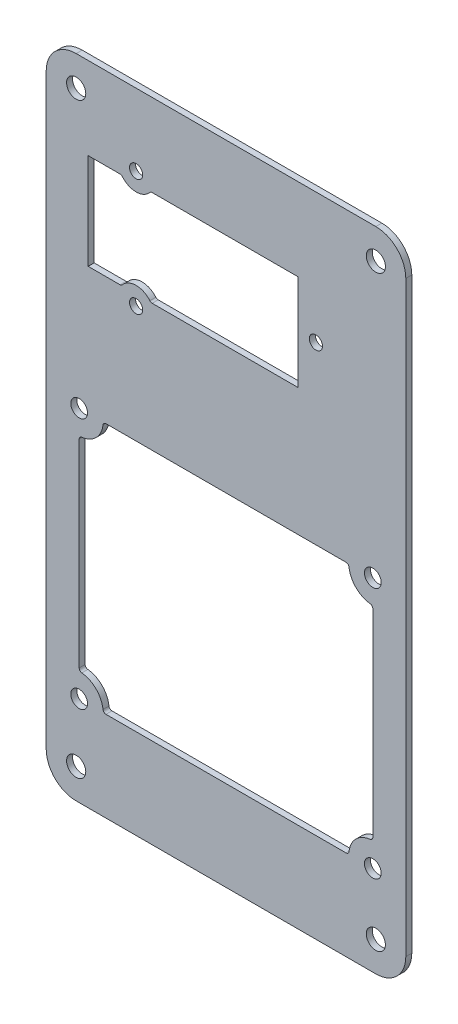
from build123d import *

# Parameters (mm, degrees)
SKETCH_1_W          = 60
SKETCH_1_H          = 108
EXTRUDE_1_DEPTH     = 1
SKETCH_4_R          = 1.4
CUT_EXTRUDE_2_DEPTH = 10
SKETCH_9_R          = 1.6
CUT_EXTRUDE_5_DEPTH = 62.781874365
FILLET_1_R          = 5
SKETCH_10_R         = 1.1
CUT_EXTRUDE_6_DEPTH = 10
CUT_EXTRUDE_7_DEPTH = 10
CUT_EXTRUDE_8_DEPTH = 10
FILLET_2_R          = 0.5
FILLET_3_R          = 0.5


with BuildPart() as part:
    # ｽｹｯﾁ1 → ﾎﾞｽ - 押し出し1 (new body)
    with BuildSketch(Plane.XY):
        Rectangle(SKETCH_1_W, SKETCH_1_H)
    extrude(amount=EXTRUDE_1_DEPTH)

    # ｽｹｯﾁ4 → ｶｯﾄ - 押し出し2 (cut)
    with BuildSketch(Plane.XY.offset(1)):
        with Locations((-24.5, 3)):
            Circle(SKETCH_4_R)
        with Locations((-24.5, -39)):
            Circle(SKETCH_4_R)
        with Locations((24.5, 3)):
            Circle(SKETCH_4_R)
        with Locations((24.5, -39)):
            Circle(SKETCH_4_R)
    extrude(amount=-CUT_EXTRUDE_2_DEPTH, mode=Mode.SUBTRACT)

    # ｽｹｯﾁ9 → ｶｯﾄ - 押し出し5 (cut, through all)
    with BuildSketch(Plane.XY.offset(1)):
        with Locations((25, 49)):
            Circle(SKETCH_9_R)
        with Locations((-25, 49)):
            Circle(SKETCH_9_R)
        with Locations((-25, -49)):
            Circle(SKETCH_9_R)
        with Locations((25, -49)):
            Circle(SKETCH_9_R)
    extrude(amount=-CUT_EXTRUDE_5_DEPTH, mode=Mode.SUBTRACT)

    # ﾌｨﾚｯﾄ1
    fillet_1_edges = [part.edges().sort_by_distance(p)[0] for p in [
        (-30, -54, 0.5),
        (30, -54, 0.5),
        (-30, 54, 0.5),
        (30, 54, 0.5),
    ]]
    fillet(fillet_1_edges, radius=FILLET_1_R)

    # ｽｹｯﾁ10 → ｶｯﾄ - 押し出し6 (cut)
    with BuildSketch(Plane.XY.offset(1)):
        with Locations((-15, 22.5)):
            Circle(SKETCH_10_R)
        with Locations((-15, 42)):
            Circle(SKETCH_10_R)
        with Locations((15, 32.25)):
            Circle(SKETCH_10_R)
    extrude(amount=-CUT_EXTRUDE_6_DEPTH, mode=Mode.SUBTRACT)

    # ｽｹｯﾁ12 → ｶｯﾄ - 押し出し7 (cut)
    with BuildSketch(Plane.XY.offset(1)):
        with BuildLine():
            ThreePointArc((-24.5, -35), (-21.671572875, -36.171572875), (-20.5, -39))
            Line((-20.5, -39), (20.5, -39))
            ThreePointArc((20.5, -39), (21.671572875, -36.171572875), (24.5, -35))
            Line((24.5, -35), (24.5, -1))
            ThreePointArc((24.5, -1), (21.671572875, 0.171572875), (20.5, 3))
            Line((20.5, 3), (-20.5, 3))
            ThreePointArc((-20.5, 3), (-21.671572875, 0.171572875), (-24.5, -1))
            Line((-24.5, -1), (-24.5, -35))
        make_face()
    extrude(amount=-CUT_EXTRUDE_7_DEPTH, mode=Mode.SUBTRACT)

    # ｽｹｯﾁ13 → ｶｯﾄ - 押し出し8 (cut)
    with BuildSketch(Plane.XY.offset(1)):
        with BuildLine():
            Line((-23, 40.25), (-23, 24.25))
            Line((-23, 24.25), (-17.436698586, 24.25))
            ThreePointArc((-17.436698586, 24.25), (-15, 25.5), (-12.563301414, 24.25))
            Line((-12.563301414, 24.25), (12, 24.25))
            Line((12, 24.25), (12, 40.25))
            Line((12, 40.25), (-12.563301414, 40.25))
            ThreePointArc((-12.563301414, 40.25), (-15, 39), (-17.436698586, 40.25))
            Line((-17.436698586, 40.25), (-23, 40.25))
        make_face()
    extrude(amount=-CUT_EXTRUDE_8_DEPTH, mode=Mode.SUBTRACT)

    # ﾌｨﾚｯﾄ2
    fillet_2_edges = [part.edges().sort_by_distance(p)[0] for p in [
        (20.5, -39, 0.5),
        (24.5, -35, 0.5),
        (24.5, -1, 0.5),
        (20.5, 3, 0.5),
        (-20.5, 3, 0.5),
        (-24.5, -1, 0.5),
        (-20.5, -39, 0.5),
        (-24.5, -35, 0.5),
    ]]
    fillet(fillet_2_edges, radius=FILLET_2_R)

    # ﾌｨﾚｯﾄ3
    fillet_3_edges = [part.edges().sort_by_distance(p)[0] for p in [
        (-12.563301414, 24.25, 0.5),
        (-17.436698586, 24.25, 0.5),
        (-17.436698586, 40.25, 0.5),
        (-12.563301414, 40.25, 0.5),
    ]]
    fillet(fillet_3_edges, radius=FILLET_3_R)


solid = part.part
